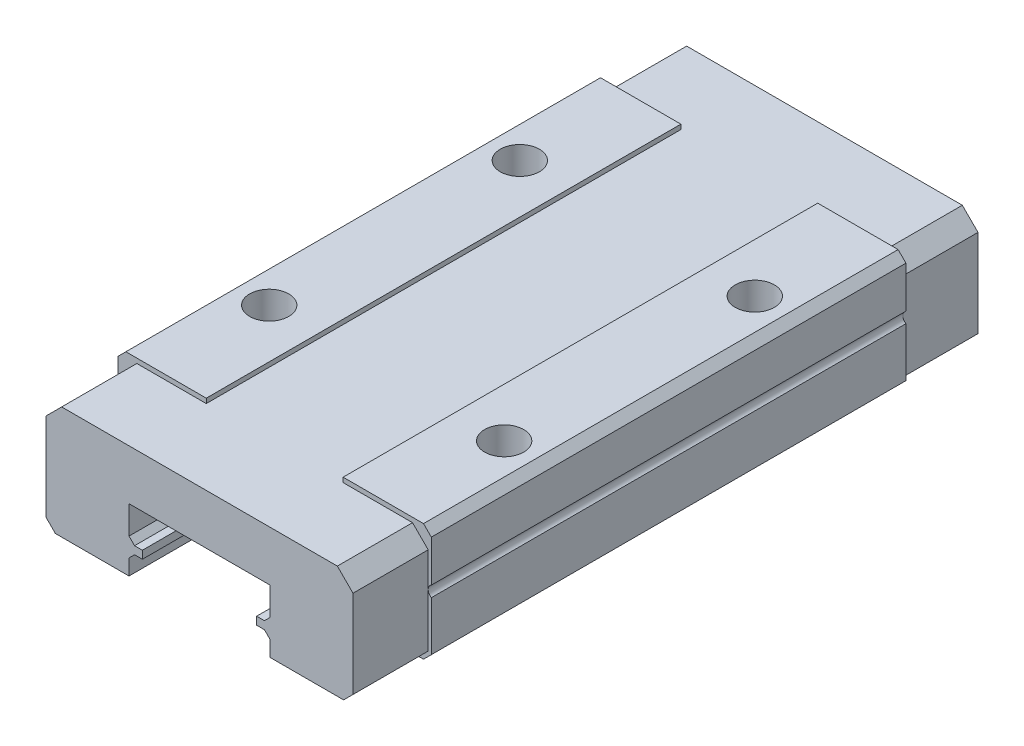
from build123d import *

# Parameters (mm, degrees)
EXTRUDE_1_DEPTH     = 39.9
CHAMFER_1_SIZE      = 0.5
CUT_EXTRUDE_1_DEPTH = 0.3
SKETCH_6_W          = 0.2
SKETCH_6_H          = 4.8
CUT_EXTRUDE_2_DEPTH = 8.3
CHAMFER_2_SIZE      = 1
CHAMFER_3_SIZE      = 0.6
CHAMFER_4_SIZE      = 0.5
SKETCH_7_R          = 0.4
CUT_EXTRUDE_3_DEPTH = 30.3


with BuildPart() as part:
    # 草图1 → 凸台-拉伸1 (new body)
    with BuildSketch(Plane.XY):
        Polygon((-10, 0), (-10, 7.5), (10, 7.5), (10, 0), (4.5, 0), (4.5, 1), (4.146446609, 1.353553391), (3.646446609, 1.353553391), (3.646446609, 1.853553391), (4.146446609, 1.853553391), (4.5, 2.207106781), (4.5, 4), (-4.5, 4), (-4.5, 2.207106781), (-4.146446609, 1.853553391), (-3.646446609, 1.853553391), (-3.646446609, 1.353553391), (-4.146446609, 1.353553391), (-4.5, 1), (-4.5, 0), align=None)
    extrude(amount=-EXTRUDE_1_DEPTH)

    # 草图3 → M3 螺纹孔1 (revolve, cut)
    with BuildSketch(Plane(origin=(7.5, 7.5, -27.95), x_dir=(0, 0, 1), z_dir=(1, 0, 0))):
        Polygon((0, 0), (0, 3.751075774), (1.25, 3), (1.25, 0), align=None)
    hole_wizard_m3_1 = revolve(axis=Axis((7.5, 13.85, -27.95), (0, -1, 0)), mode=Mode.SUBTRACT)

    # 镜向1: M3 螺纹孔1 across plane
    add(hole_wizard_m3_1.mirror(Plane(origin=(0, 0, -19.95), x_dir=(1, 0, 0), z_dir=(0, 0, -1))), mode=Mode.SUBTRACT)

    # 镜向2: M3 螺纹孔1 across plane
    add(hole_wizard_m3_1.mirror(Plane.ZY), mode=Mode.SUBTRACT)

    # 镜向2 copy 1 sketch → 镜向2 copy 1 (revolve, cut)
    with BuildSketch(Plane(origin=(-7.5, 7.5, -11.95), x_dir=(0, 0, -1), z_dir=(-1, 0, 0))):
        Polygon((0, 0), (0, 3.751075774), (1.25, 3), (1.25, 0), align=None)
    revolve(axis=Axis((-7.5, 13.85, -11.95), (0, -1, 0)), mode=Mode.SUBTRACT)

    # 倒角1
    chamfer_1_edges = [part.edges().sort_by_distance(p)[0] for p in [
        (10, 7.5, -19.95),
        (-10, 7.5, -19.95),
    ]]
    chamfer(chamfer_1_edges, length=CHAMFER_1_SIZE)

    # 草图5 → 切除-拉伸1 (cut)
    with BuildSketch(Plane(origin=(0, 7.5, 0), x_dir=(1, 0, 0), z_dir=(0, 1, 0))):
        Polygon((-9.5, 35.1), (-4.368581018, 35.1), (-4.368581018, 4.8), (-9.5, 4.8), (-10, 4.8), (-10, 0), (10, 0), (10, 4.8), (9.5, 4.8), (4.368581018, 4.8), (4.368581018, 35.1), (9.5, 35.1), (10, 35.1), (10, 39.9), (-10, 39.9), (-10, 35.1), align=None)
    extrude(amount=-CUT_EXTRUDE_1_DEPTH, mode=Mode.SUBTRACT)

    # 草图6 → 切除-拉伸2 (cut)
    with BuildSketch(Plane(origin=(0, 7.2, 0), x_dir=(1, 0, 0), z_dir=(0, 1, 0))):
        with Locations((-9.9, 37.5)):
            Rectangle(SKETCH_6_W, SKETCH_6_H)
        with Locations((9.9, 37.5)):
            Rectangle(SKETCH_6_W, SKETCH_6_H)
        with Locations((9.9, 2.4)):
            Rectangle(SKETCH_6_W, SKETCH_6_H)
        with Locations((-9.9, 2.4)):
            Rectangle(SKETCH_6_W, SKETCH_6_H)
    extrude(amount=-CUT_EXTRUDE_2_DEPTH, mode=Mode.SUBTRACT)

    # 倒角2
    # the kernel refuses this chamfer: 1 mm, written as the material it takes off along each edge
    with BuildSketch(Plane(origin=(-9.8, 7.2, -4.8), x_dir=(-0.027495876610583895, -0.9996219169112968, 0), z_dir=(0, 0, 1)), Plane(origin=(-9.8, 7.2, -42.471682988), x_dir=(-0.027495876610585623, -0.9996219169112968, 0), z_dir=(0, 0, 1))) as chamfer_2_piece_1:
        Polygon((CHAMFER_2_SIZE * 0.999621916911, CHAMFER_2_SIZE * 0.0274958766106), (-CHAMFER_2_SIZE * 0.0274958766106, CHAMFER_2_SIZE * 0.999621916911), (0, 0), align=None)
    extrude(amount=7.371682988, mode=Mode.SUBTRACT)
    with BuildSketch(Plane(origin=(9.8, 7.2, 2.571682988), x_dir=(-0.9996219169112968, 0.02749587661058651, 0), z_dir=(0, 0, -1)), Plane(origin=(9.8, 7.2, -35.1), x_dir=(-0.9996219169112968, 0.02749587661058651, 0), z_dir=(0, 0, -1))) as chamfer_2_piece_2:
        Polygon((CHAMFER_2_SIZE * 0.999621916911, -CHAMFER_2_SIZE * 0.0274958766106), (-CHAMFER_2_SIZE * 0.0274958766106, -CHAMFER_2_SIZE * 0.999621916911), (0, 0), align=None)
    extrude(amount=7.371682988, mode=Mode.SUBTRACT)

    # 倒角3
    chamfer_3_edges = [part.edges().sort_by_distance(p)[0] for p in [
        (-9.8, 0, -37.5),
        (9.8, 0, -37.5),
        (9.8, 0, -2.4),
        (-9.8, 0, -2.4),
    ]]
    chamfer(chamfer_3_edges, length=CHAMFER_3_SIZE)

    # 倒角4
    chamfer_4_edges = [part.edges().sort_by_distance(p)[0] for p in [
        (-10, 0, -19.95),
        (10, 0, -19.95),
    ]]
    chamfer(chamfer_4_edges, length=CHAMFER_4_SIZE)

    # 草图7 → 切除-拉伸3 (cut)
    with BuildSketch(Plane(origin=(0, 0, -35.1), x_dir=(-1, 0, 0), z_dir=(0, 0, -1))):
        with Locations((-10.2, 4)):
            Circle(SKETCH_7_R)
    extrude(amount=-CUT_EXTRUDE_3_DEPTH, mode=Mode.SUBTRACT)


solid = part.part
